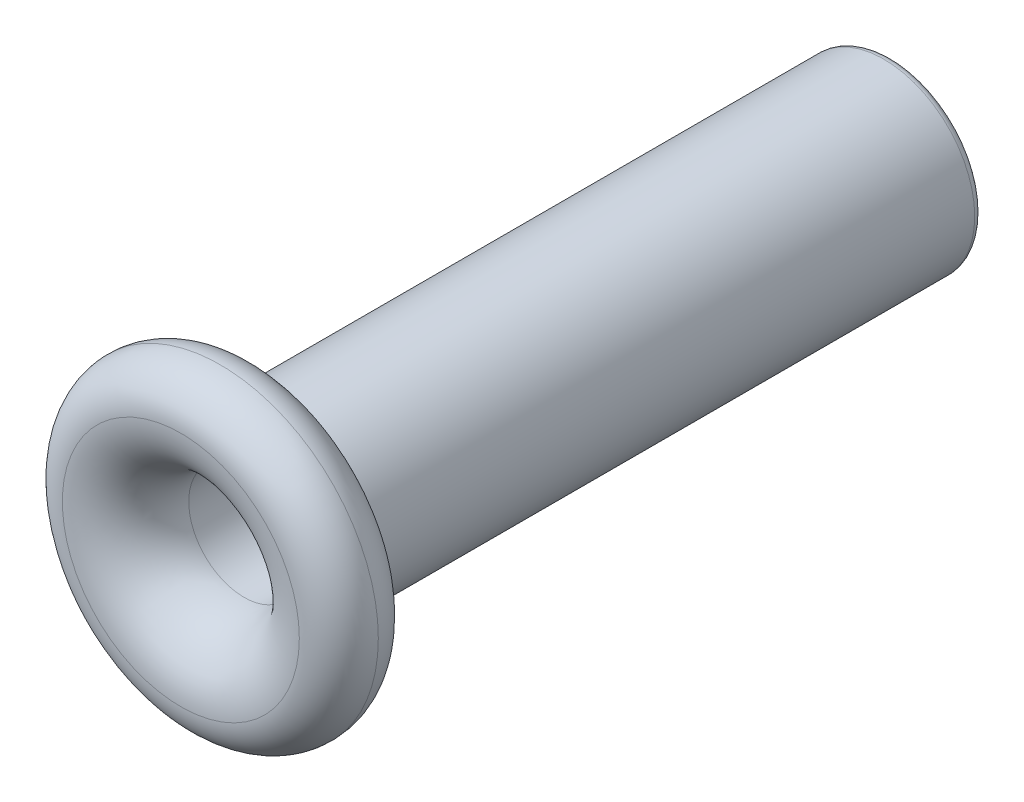
from build123d import *

# Parameters (mm, degrees)
SKIZZE1_R                       = 11.5
AUFSATZ_LINEAR_AUSTRAGEN3_DEPTH = 80
SKIZZE4_R                       = 9
SCHNITT_LINEAR_AUSTRAGEN2_DEPTH = 10
VERRUNDUNG1_R                   = 1
VERRUNDUNG2_R                   = 1
SKIZZE5_R                       = 20
AUFSATZ_LINEAR_AUSTRAGEN4_DEPTH = 10
VERRUNDUNG3_R                   = 5
SKIZZE6_R                       = 7
SCHNITT_LINEAR_AUSTRAGEN3_DEPTH = 75
VERRUNDUNG4_R                   = 7
VERRUNDUNG5_R                   = 8


with BuildPart() as part:
    # Skizze1 → Aufsatz-Linear austragen3 (new body)
    with BuildSketch(Plane.XY):
        Circle(SKIZZE1_R)
    extrude(amount=AUFSATZ_LINEAR_AUSTRAGEN3_DEPTH)

    # Skizze4 → Schnitt-Linear austragen2 (cut)
    with BuildSketch(Plane(origin=(0, 0, 0), x_dir=(-1, 0, 0), z_dir=(0, 0, -1))):
        Circle(SKIZZE4_R)
    extrude(amount=-SCHNITT_LINEAR_AUSTRAGEN2_DEPTH, mode=Mode.SUBTRACT)

    # Verrundung1
    verrundung1_edges = [part.edges().sort_by_distance(p)[0] for p in [
        (-11.5, 0, 0),
        (9, 0, 0),
    ]]
    fillet(verrundung1_edges, radius=VERRUNDUNG1_R)

    # Verrundung2
    verrundung2_edges = [part.edges().sort_by_distance(p)[0] for p in [
        (9, 0, 10),
    ]]
    fillet(verrundung2_edges, radius=VERRUNDUNG2_R)

    # Skizze5 → Aufsatz-Linear austragen4 (add)
    with BuildSketch(Plane.XY.offset(80)):
        Circle(SKIZZE5_R)
    extrude(amount=AUFSATZ_LINEAR_AUSTRAGEN4_DEPTH)

    # Verrundung3
    verrundung3_edges = [part.edges().sort_by_distance(p)[0] for p in [
        (-20, 0, 80),
        (-20, 0, 90),
    ]]
    fillet(verrundung3_edges, radius=VERRUNDUNG3_R - 0.0001)  # a hair under: the kernel refuses the full size

    # Skizze6 → Schnitt-Linear austragen3 (cut)
    with BuildSketch(Plane.XY.offset(90)):
        Circle(SKIZZE6_R)
    extrude(amount=-SCHNITT_LINEAR_AUSTRAGEN3_DEPTH, mode=Mode.SUBTRACT)

    # Verrundung4
    verrundung4_edges = [part.edges().sort_by_distance(p)[0] for p in [
        (-7, 0, 15),
    ]]
    fillet(verrundung4_edges, radius=VERRUNDUNG4_R)

    # Verrundung5
    verrundung5_edges = [part.edges().sort_by_distance(p)[0] for p in [
        (-7, 0, 90),
    ]]
    fillet(verrundung5_edges, radius=VERRUNDUNG5_R)


solid = part.part
